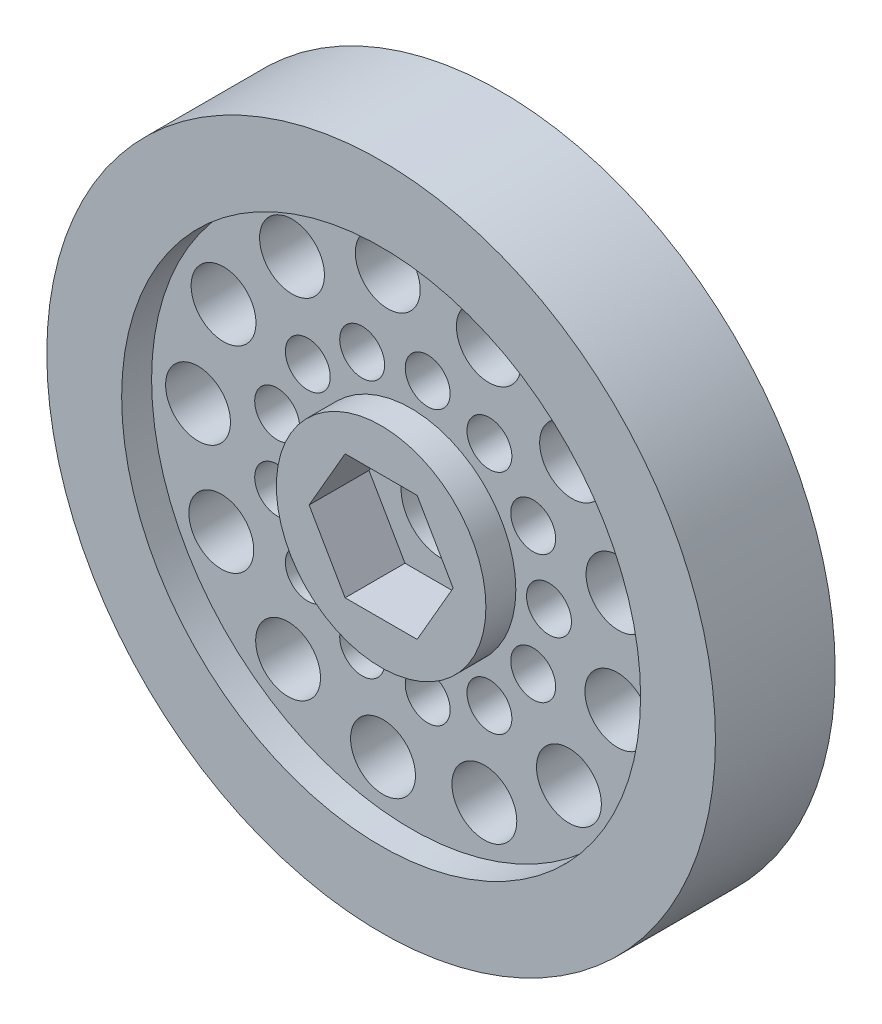
from build123d import *

# Parameters (mm, degrees)
SKETCH1_R           = 33.5
SKETCH1_R_2         = 4
BOSS_EXTRUDE1_DEPTH = 12
CUT_EXTRUDE1_DEPTH  = 6
SKETCH3_R           = 26
SKETCH3_R_2         = 10.5
CUT_EXTRUDE2_DEPTH  = 3
CUT_EXTRUDE3_START  = -3
SKETCH4_R           = 26
SKETCH4_R_2         = 10.5
CUT_EXTRUDE3_DEPTH  = 3
SKETCH5_R           = 2.25
SKETCH5_R_2         = 3.25
CUT_EXTRUDE4_DEPTH  = 10
CIRPATTERN1_COUNT   = 13


with BuildPart() as part:
    # Sketch1 → Boss-Extrude1 (new body)
    with BuildSketch(Plane.XY):
        Circle(SKETCH1_R)
        Circle(SKETCH1_R_2, mode=Mode.SUBTRACT)
    extrude(amount=BOSS_EXTRUDE1_DEPTH)

    # Sketch2 → Cut-Extrude1 (cut)
    with BuildSketch(Plane.XY.offset(12)):
        Polygon((7.216878365, 0), (3.608439182, 6.25), (-3.608439182, 6.25), (-7.216878365, 0), (-3.608439182, -6.25), (3.608439182, -6.25), align=None)
    extrude(amount=-CUT_EXTRUDE1_DEPTH, mode=Mode.SUBTRACT)

    # Sketch3 → Cut-Extrude2 (cut)
    with BuildSketch(Plane.XY.offset(12)):
        Circle(SKETCH3_R)
        Circle(SKETCH3_R_2, mode=Mode.SUBTRACT)
    extrude(amount=-CUT_EXTRUDE2_DEPTH, mode=Mode.SUBTRACT)

    # Sketch4 → Cut-Extrude3 (cut)
    with BuildSketch(Plane(origin=(0, 0, 0), x_dir=(-1, 0, 0), z_dir=(0, 0, -1)).offset(CUT_EXTRUDE3_START)):
        Circle(SKETCH4_R)
        Circle(SKETCH4_R_2, mode=Mode.SUBTRACT)
    extrude(amount=CUT_EXTRUDE3_DEPTH, mode=Mode.SUBTRACT)

    # Sketch5 → Cut-Extrude4 (cut)
    with BuildSketch(Plane.XY.offset(9)):
        with Locations((13.82072024, 0)):
            Circle(SKETCH5_R)
        with Locations((20.783512616, 4.875399709)):
            Circle(SKETCH5_R_2)
    cut_extrude4 = extrude(amount=-CUT_EXTRUDE4_DEPTH, mode=Mode.SUBTRACT)

    # CirPattern1: Cut-Extrude4 ×13 about axis
    cirpattern1_axis = Axis((0, 0, 6), (0, 0, 1))
    for i in range(1, CIRPATTERN1_COUNT):
        add(cut_extrude4.rotate(cirpattern1_axis, i * 360 / CIRPATTERN1_COUNT), mode=Mode.SUBTRACT)


solid = part.part
